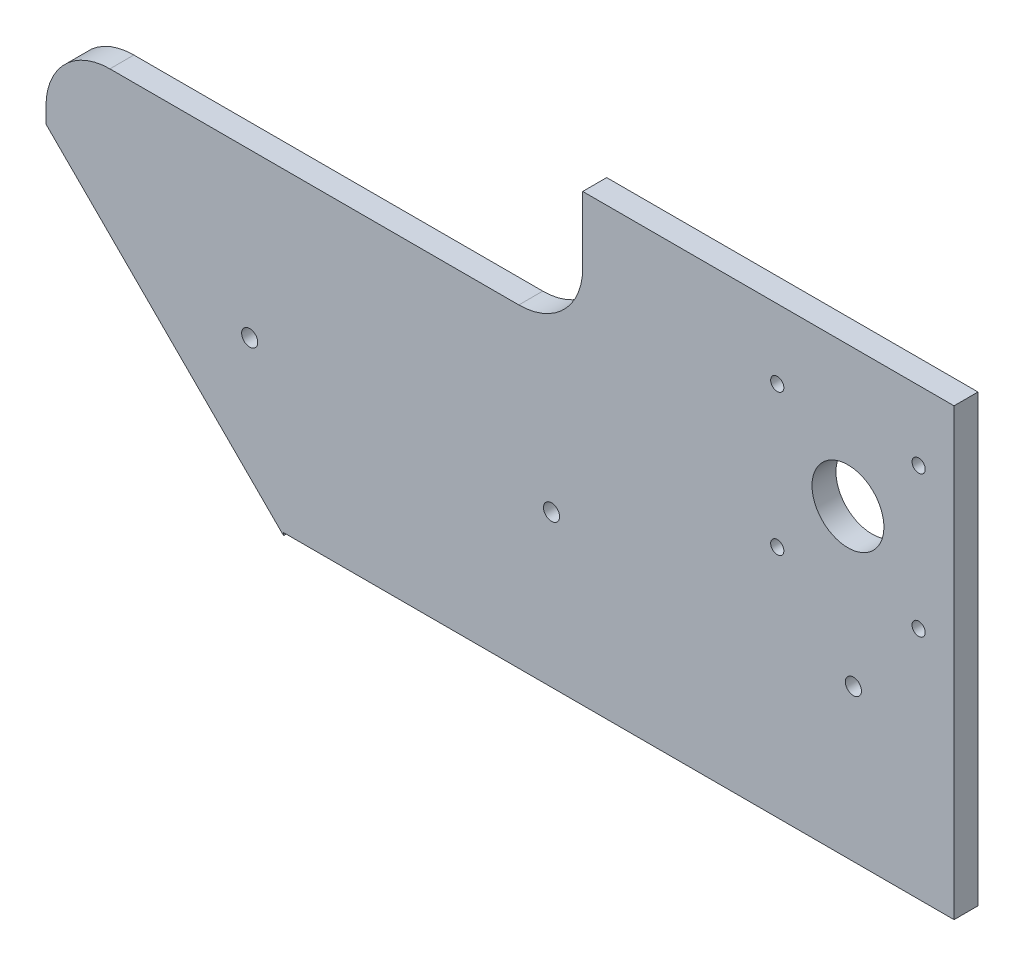
from build123d import *

# Parameters (mm, degrees)
SKETCH1_R                    = 14.2875
BOSS_EXTRUDE1_DEPTH          = 9.525
SKETCH2_W                    = 285.57287806
SKETCH2_H                    = 77.089
CUT_EXTRUDE1_DEPTH           = 267.58430025
SKETCH4_W                    = 213.36
SKETCH4_H                    = 65.465352004
CUT_EXTRUDE2_DEPTH           = 267.58430025
FILLET2_R                    = 25.4
SKETCH16_W                   = 9.525
SKETCH16_H                   = 0.985363282
CUT_EXTRUDE3_DEPTH           = 390.572219806
SKETCH17_W                   = 147.610011278
SKETCH17_H                   = 12.7
CUT_EXTRUDE4_DEPTH           = 267.045158533
TAP_DRILL_FOR_M6X0_75_TAP1_D = 5.25
F_6_4_6_4_DIAMETER_HOLE1_D   = 6.4


with BuildPart() as part:
    # Sketch1 → Boss-Extrude1 (new body)
    with BuildSketch(Plane.XY):
        Polygon((-138.259383474, 48.991487021), (32.210627804, -121.478524257), (222.710627804, -121.478524257), (222.710627804, 146.206839025), (-138.259383474, 146.206839025), align=None)
        with Locations((180.538014078, 76.831975743)):
            Circle(SKETCH1_R, mode=Mode.SUBTRACT)
    extrude(amount=BOSS_EXTRUDE1_DEPTH)

    # Sketch2 → Cut-Extrude1 (cut, through all)
    with BuildSketch(Plane.XY.offset(9.525)):
        with Locations((98.974188774, -82.934024257)):
            Rectangle(SKETCH2_W, SKETCH2_H)
    extrude(amount=-CUT_EXTRUDE1_DEPTH, mode=Mode.SUBTRACT)

    # Sketch4 → Cut-Extrude2 (cut, through all)
    with BuildSketch(Plane.XY.offset(9.525)):
        with Locations((-31.579383474, 113.474163023)):
            Rectangle(SKETCH4_W, SKETCH4_H)
    extrude(amount=-CUT_EXTRUDE2_DEPTH, mode=Mode.SUBTRACT)

    # Fillet2
    fillet2_edges = [part.edges().sort_by_distance(p)[0] for p in [
        (-138.259383474, 80.741487021, 4.7625),
        (75.100616526, 80.741487021, 4.7625),
    ]]
    fillet(fillet2_edges, radius=FILLET2_R)

    # Sketch16 → Cut-Extrude3 (cut, through all)
    with BuildSketch(Plane(origin=(222.710627804, 0, 0), x_dir=(0, 0, -1), z_dir=(1, 0, 0))):
        with Locations((-4.7625, 145.714157384)):
            Rectangle(SKETCH16_W, SKETCH16_H)
    extrude(amount=-CUT_EXTRUDE3_DEPTH, mode=Mode.SUBTRACT)

    # Sketch17 → Cut-Extrude4 (cut, through all)
    with BuildSketch(Plane(origin=(0, 0, 0), x_dir=(-1, 0, 0), z_dir=(0, 0, -1))):
        with Locations((-148.905622165, 138.871475743)):
            Rectangle(SKETCH17_W, SKETCH17_H)
    extrude(amount=-CUT_EXTRUDE4_DEPTH, mode=Mode.SUBTRACT)

    # Tap Drill for M6x0.75 Tap1 (through all)
    with Locations(Plane.XY.offset(9.525)):
        with Locations((208.638014078, 104.931975743), (152.438014078, 104.931975743), (152.438014078, 48.731975743), (208.638014078, 48.731975743)):
            Hole(TAP_DRILL_FOR_M6X0_75_TAP1_D / 2)

    # Ø6.4 (6.4) Diameter Hole1 (through all)
    with Locations(Plane.XY.offset(9.525)):
        with Locations((-57.289372206, 15.935475743), (62.710627794, 15.935475743), (182.710627794, 15.935475743)):
            Hole(F_6_4_6_4_DIAMETER_HOLE1_D / 2)


solid = part.part
